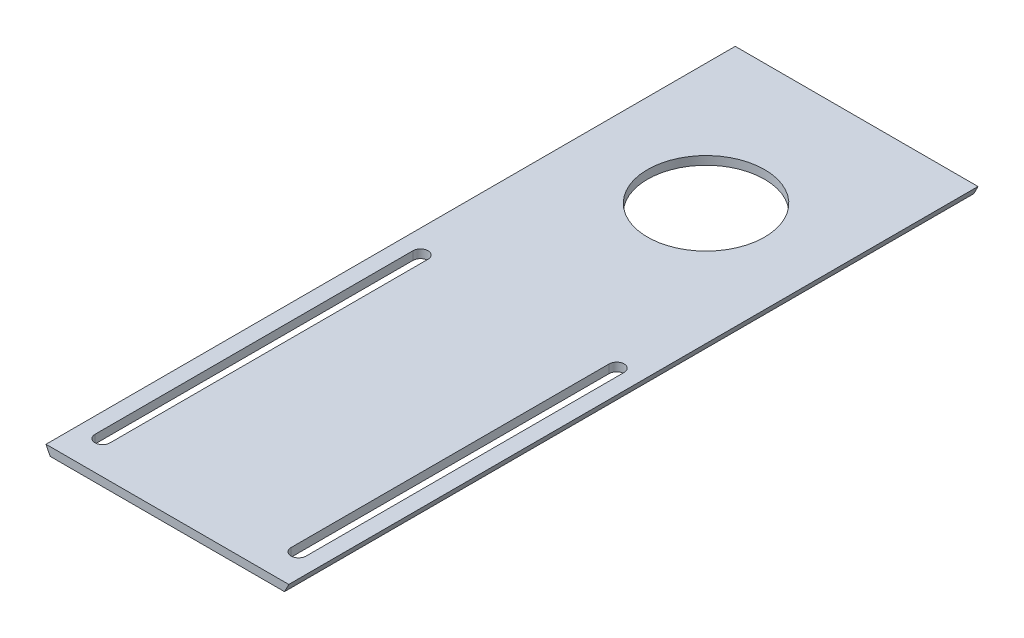
from build123d import *

# Parameters (mm, degrees)
BOSS_EXTRUDE1_DEPTH = 261.62
SKETCH3_R           = 22.225
CUT_EXTRUDE1_DEPTH  = 266.665663227


with BuildPart() as part:
    # Sketch2 → Boss-Extrude1 (new body)
    with BuildSketch(Plane.XY):
        with BuildLine():
            Line((-44.45, -24.593444248), (44.45, -24.593444248))
            ThreePointArc((44.45, -24.593444248), (45.291168316, -23.007609015), (46.075781684, -21.393044248))
            Line((46.075781684, -21.393044248), (-46.075781684, -21.393044248))
            ThreePointArc((-46.075781684, -21.393044248), (-45.291168316, -23.007609015), (-44.45, -24.593444248))
        make_face()
    extrude(amount=BOSS_EXTRUDE1_DEPTH)

    # Sketch3 → Cut-Extrude1 (cut, through all)
    with BuildSketch(Plane.XZ.offset(24.593444248)):
        with Locations((0, 57.15)):
            Circle(SKETCH3_R)
        with BuildLine():
            Line((-40.053517537, 128.317412284), (-40.053517537, 249.024041398))
            ThreePointArc((-40.053517537, 249.024041398), (-37.219693042, 251.857865893), (-34.385868547, 249.024041398))
            Line((-34.385868547, 249.024041398), (-34.385868547, 128.317412284))
            ThreePointArc((-34.385868547, 128.317412284), (-37.219693042, 125.483587789), (-40.053517537, 128.317412284))
        make_face()
        with BuildLine():
            Line((34.385868547, 128.317412284), (34.385868547, 249.024041398))
            ThreePointArc((34.385868547, 249.024041398), (37.219693042, 251.857865893), (40.053517537, 249.024041398))
            Line((40.053517537, 249.024041398), (40.053517537, 128.317412284))
            ThreePointArc((40.053517537, 128.317412284), (37.219693042, 125.483587789), (34.385868547, 128.317412284))
        make_face()
    extrude(amount=-CUT_EXTRUDE1_DEPTH, mode=Mode.SUBTRACT)


solid = part.part
